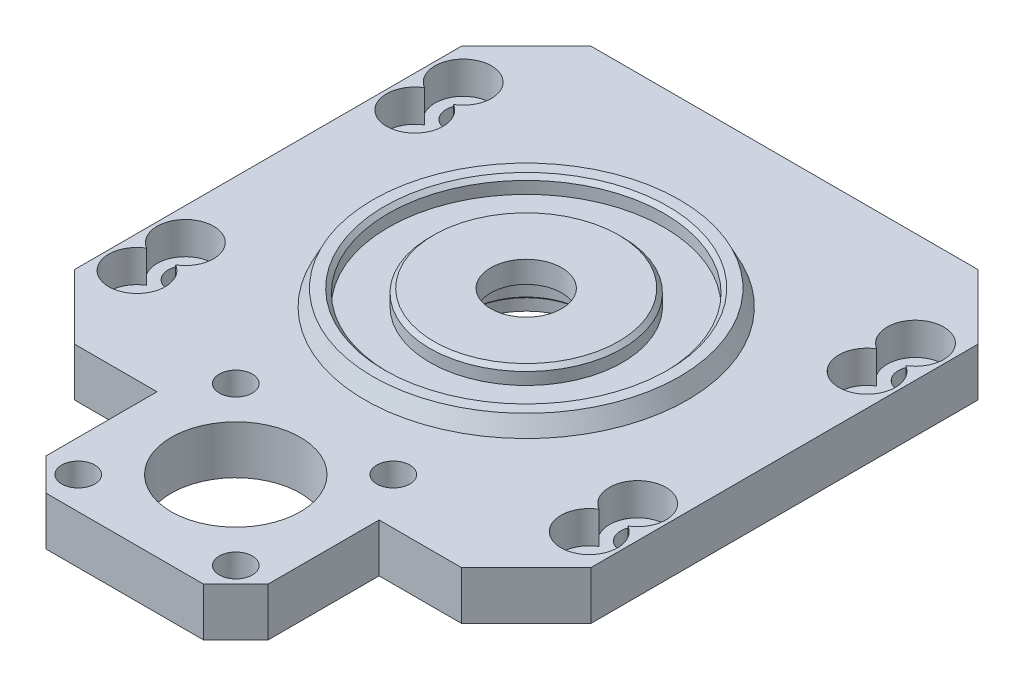
from build123d import *

# Parameters (mm, degrees)
SKETCH4_W                                        = 101.6
SKETCH4_H                                        = 101.6
BOSS_EXTRUDE1_DEPTH                              = 9.525
SKETCH14_R                                       = 26.9875
SKETCH14_R_2                                     = 19.0881
CUT_EXTRUDE2_DEPTH                               = 3.175
MOVE_FACE1_BY                                    = 0.127
MOVE_FACE1_2_BY                                  = 0.127
F_3_8_CLEARANCE_HOLE1_D                          = 13.97
SKETCH19_W                                       = 43.7
SKETCH19_H                                       = 28.2
BOSS_EXTRUDE4_DEPTH                              = 9.525
CBORE_FOR_M3_SHCS1_D                             = 3.4
CBORE_FOR_M3_SHCS1_CBORE_D                       = 6.5
CBORE_FOR_M3_SHCS1_CBORE_DEPTH                   = 3
MOVE_FACE4_BY                                    = 1.5875
MOVE_FACE4_2_BY                                  = 1.5875
MOVE_FACE4_3_BY                                  = 1.5875
MOVE_FACE4_4_BY                                  = 1.5875
SKETCH11_R                                       = 12.7
CUT_EXTRUDE1_DEPTH                               = 95.405326253
CHAMFER1_SIZE                                    = 0.79375
BODY_MOVE_COPY2_ANGLE                            = 180
SKETCH21_R                                       = 3.25
CUT_EXTRUDE3_DEPTH                               = 4.7625
CHAMFER2_SIZE                                    = 12.7
CHAMFER3_SIZE                                    = 6.35
CBORE_FOR_1_4_SOCKET_HEAD_CAP_SCREW1_D           = 6.7564
CBORE_FOR_1_4_SOCKET_HEAD_CAP_SCREW1_CBORE_D     = 11.1125
CBORE_FOR_1_4_SOCKET_HEAD_CAP_SCREW1_CBORE_DEPTH = 6.35
MIRROR2_COPY_1_D                                 = 6.7564
MIRROR2_COPY_1_CBORE_D                           = 11.1125
MIRROR2_COPY_1_CBORE_DEPTH                       = 6.35


with BuildPart() as part:
    # Sketch4 → Boss-Extrude1 (new body)
    with BuildSketch(Plane(origin=(0, 0, 0), x_dir=(1, 0, 0), z_dir=(0, 1, 0))):
        Rectangle(SKETCH4_W, SKETCH4_H)
    extrude(amount=BOSS_EXTRUDE1_DEPTH)

    # Sketch5 → Revolve1 (revolve)
    with BuildSketch(Plane(origin=(0, 0, 0), x_dir=(0, 0, -1), z_dir=(1, 0, 0))):
        Polygon((0, 9.525), (0, 12.7), (30.1625, 12.7), (31.75, 9.525), align=None)
    revolve(axis=Axis((0, 0, 0), (0, 1, 0)))

    # Sketch14 → Cut-Extrude2 (cut)
    with BuildSketch(Plane(origin=(0, 12.7, 0), x_dir=(1, 0, 0), z_dir=(0, 1, 0))):
        with Locations(Location((0, 0, 0), (0, 0, 270))):
            Circle(SKETCH14_R)
        with Locations(Location((0, 0, 0), (0, 0, 270))):
            Circle(SKETCH14_R_2, mode=Mode.SUBTRACT)
    extrude(amount=-CUT_EXTRUDE2_DEPTH, mode=Mode.SUBTRACT)

    # Move Face1: a curved face moved inward by 0.127
    add(Solid.thicken(part.faces().sort_by_distance((0, 11.1125, -19.0881))[0], -MOVE_FACE1_BY), mode=Mode.SUBTRACT)

    # Move Face1 2: a curved face moved inward by 0.127
    add(Solid.thicken(part.faces().sort_by_distance((0, 11.1125, -26.9875))[0], -MOVE_FACE1_2_BY), mode=Mode.SUBTRACT)

    # 3/8 Clearance Hole1 (through all)
    with Locations(Plane(origin=(0, 12.7, 0), x_dir=(1, 0, 0), z_dir=(0, 1, 0))):
        with Locations((0, 0)):
            Hole(F_3_8_CLEARANCE_HOLE1_D / 2)

    # Sketch19 → Boss-Extrude4 (add)
    with BuildSketch(Plane(origin=(0, 9.525, 0), x_dir=(1, 0, 0), z_dir=(0, 1, 0))):
        with Locations((0, -64.9)):
            Rectangle(SKETCH19_W, SKETCH19_H)
    extrude(amount=-BOSS_EXTRUDE4_DEPTH)

    # CBORE for M3 SHCS1 (through all)
    with Locations(Plane(origin=(0, 9.525, 0), x_dir=(1, 0, 0), z_dir=(0, 1, 0))):
        with Locations((-15.5, -41.65), (15.5, -41.65), (15.5, -72.65), (-15.5, -72.65)):
            CounterBoreHole(CBORE_FOR_M3_SHCS1_D / 2, CBORE_FOR_M3_SHCS1_CBORE_D / 2, CBORE_FOR_M3_SHCS1_CBORE_DEPTH)

    # Move Face4: a face moved inward by 1.5875
    extrude(part.faces().sort_by_distance((15.5, 6.525, 44.25))[0], amount=MOVE_FACE4_BY, dir=(0, -1, 0), mode=Mode.SUBTRACT)

    # Move Face4 2: a face moved inward by 1.5875
    extrude(part.faces().sort_by_distance((-15.5, 6.525, 44.25))[0], amount=MOVE_FACE4_2_BY, dir=(0, -1, 0), mode=Mode.SUBTRACT)

    # Move Face4 3: a face moved inward by 1.5875
    extrude(part.faces().sort_by_distance((-15.5, 6.525, 75.25))[0], amount=MOVE_FACE4_3_BY, dir=(0, -1, 0), mode=Mode.SUBTRACT)

    # Move Face4 4: a face moved inward by 1.5875
    extrude(part.faces().sort_by_distance((15.5, 6.525, 75.25))[0], amount=MOVE_FACE4_4_BY, dir=(0, -1, 0), mode=Mode.SUBTRACT)

    # Sketch11 → Cut-Extrude1 (cut, through all)
    with BuildSketch(Plane(origin=(0, 9.525, 0), x_dir=(1, 0, 0), z_dir=(0, 1, 0))):
        with Locations(Location((0, -57.15, 0), (0, 0, 270))):
            Circle(SKETCH11_R)
    extrude(amount=-CUT_EXTRUDE1_DEPTH, mode=Mode.SUBTRACT)

    # Chamfer1
    chamfer1_edges = [part.edges().sort_by_distance(p)[0] for p in [
        (0, 12.7, -27.1145),
        (0, 12.7, -18.9611),
    ]]
    chamfer(chamfer1_edges, length=CHAMFER1_SIZE)


with BuildPart() as body_2:
    # uxcell-FR6ZZ: read off the stored shape, not the designer's step
    # uxcell-FR6ZZ outline → uxcell-FR6ZZ (revolve)
    with BuildSketch(Plane(origin=(-24.054896115, 0, 40.177492641), x_dir=(1, 0, 0), z_dir=(0, 0, 1))):
        Polygon((12.430125, -6.322384388), (4.7625, -6.322384388), (4.7625, -14.736134388), (11.2395, -14.736134388), (11.2395, -9.576759388), (11.636375, -9.179884388), (12.430125, -9.179884388), align=None)
    revolve(axis=Axis((-24.054896115, 0, 40.177492641), (0, 1, 0)))


with BuildPart() as body_2_1:
    # Body-Move/Copy2: read off the stored shape, not the designer's step
    # Body-Move/Copy2: moved
    add(body_2.part.moved(Location((24.0548961, 6.3223844, -40.1774926))).rotate(Axis((0, 0, 0), (0.9584281675, 0, 0.2853339234)), BODY_MOVE_COPY2_ANGLE))


with BuildPart() as part_1:
    add(part.part)

    # Combine1: cut body 2
    add(body_2_1.part, mode=Mode.SUBTRACT)

    # Sketch21 → Cut-Extrude3 (cut)
    with BuildSketch(Plane(origin=(0, 9.525, 0), x_dir=(1, 0, 0), z_dir=(0, 1, 0))):
        with Locations(Location((-15.5, -72.65, 0), (0, 0, 270))):
            Circle(SKETCH21_R)
        with Locations(Location((15.5, -72.65, 0), (0, 0, 270))):
            Circle(SKETCH21_R)
        with Locations(Location((15.5, -41.65, 0), (0, 0, 270))):
            Circle(SKETCH21_R)
        with Locations(Location((-15.5, -41.65, 0), (0, 0, 270))):
            Circle(SKETCH21_R)
    extrude(amount=-CUT_EXTRUDE3_DEPTH, mode=Mode.SUBTRACT)

    # Chamfer2
    chamfer2_edges = [part_1.edges().sort_by_distance(p)[0] for p in [
        (50.8, 4.7625, 50.8),
        (-50.8, 4.7625, 50.8),
        (-50.8, 4.7625, -50.8),
        (50.8, 4.7625, -50.8),
    ]]
    chamfer(chamfer2_edges, length=CHAMFER2_SIZE)

    # Chamfer3
    chamfer3_edges = [part_1.edges().sort_by_distance(p)[0] for p in [
        (-21.85, 4.7625, 79),
        (21.85, 4.7625, 79),
    ]]
    chamfer(chamfer3_edges, length=CHAMFER3_SIZE)

    # CBORE for 1/4 Socket Head Cap Screw1 (through all)
    with Locations(Plane(origin=(0, 9.525, 0), x_dir=(1, 0, 0), z_dir=(0, 1, 0))):
        with Locations((-44.500451365, 32.095919635), (-44.500451365, 22.570919635)):
            cbore_for_1_4_socket_head_cap_screw1 = CounterBoreHole(CBORE_FOR_1_4_SOCKET_HEAD_CAP_SCREW1_D / 2, CBORE_FOR_1_4_SOCKET_HEAD_CAP_SCREW1_CBORE_D / 2, CBORE_FOR_1_4_SOCKET_HEAD_CAP_SCREW1_CBORE_DEPTH)

    # Mirror1: CBORE for 1/4 Socket Head Cap Screw1 across plane
    add(cbore_for_1_4_socket_head_cap_screw1.mirror(Plane.XY), mode=Mode.SUBTRACT)

    # Mirror2: CBORE for 1/4 Socket Head Cap Screw1 across plane
    add(cbore_for_1_4_socket_head_cap_screw1.mirror(Plane(origin=(0, 0, 0), x_dir=(0, 0, 1), z_dir=(1, 0, 0))), mode=Mode.SUBTRACT)

    # Mirror2 copy 1 (through all)
    with Locations(Plane(origin=(0, 9.525, 0), x_dir=(-1, 0, 0), z_dir=(0, 1, 0))):
        with Locations((-44.500451365, 32.095919635), (-44.500451365, 22.570919635)):
            CounterBoreHole(MIRROR2_COPY_1_D / 2, MIRROR2_COPY_1_CBORE_D / 2, MIRROR2_COPY_1_CBORE_DEPTH)


solid = part_1.part
